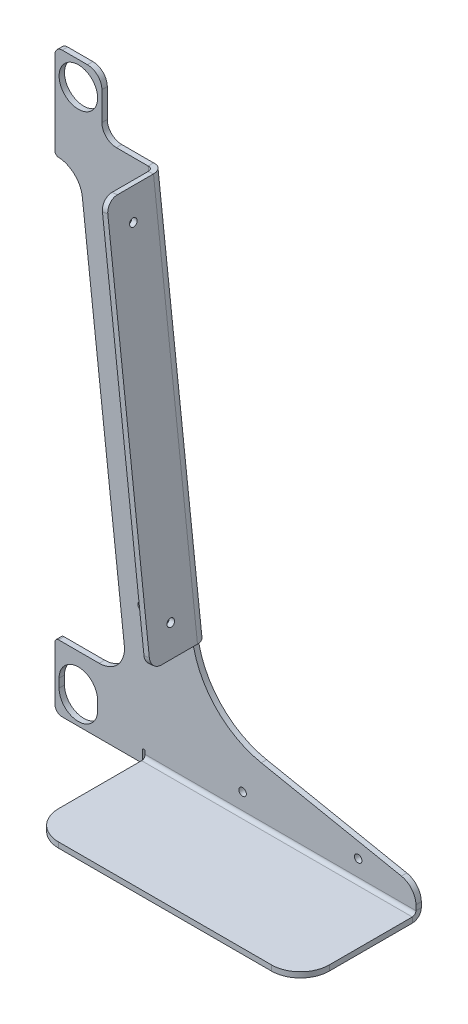
from build123d import *

# Parameters (mm, degrees)
BOSS_EXTRUDE1_DEPTH      = 3.175
SKETCH2_R                = 16.9545
CUT_EXTRUDE1_DEPTH       = 600.06621556
FILLET1_R                = 15.875
CONVERT_SOLID1_START     = -1.5875
CONVERT_SOLID1_OUTLINE_R = 16.9545
CONVERT_SOLID1_DEPTH     = 1.5875
EDGE_FLANGE1_START       = 76.99375
EDGE_FLANGE1_DEPTH       = 240.50625
EDGE_FLANGE1_START_2     = 79.375
EDGE_FLANGE1_2_DEPTH     = 238.125
EDGE_FLANGE1_START_3     = -3
EDGE_FLANGE1_3_DEPTH     = 9.35
FILLET2_R                = 25.4
FILLET3_R                = 3.175
CUT_EXTRUDE2_DEPTH       = 4.7625
FILLET4_R                = 3.175
EDGE_FLANGE3_DEPTH       = 341.057724741
FILLET5_R                = 9.525
CUT_EXTRUDE3_DEPTH       = 4.7625
FILLET7_R                = 12.7
SKETCH17_R               = 3.302
CUT_EXTRUDE4_DEPTH       = 608.612384802
CUT_EXTRUDE5_DEPTH       = 608.612384802
SKETCH19_R               = 3.302
CUT_EXTRUDE6_DEPTH       = 533.561746786


with BuildPart() as part:
    # Sketch1 → Boss-Extrude1 (new body)
    with BuildSketch(Plane.XY):
        with BuildLine():
            Line((6.35, 0), (317.5, 0))
            Line((317.5, 0), (317.5, 25.4))
            Line((317.5, 25.4), (181.457249023, 52.608550195))
            ThreePointArc((181.457249023, 52.608550195), (140.315142877, 75.746018143), (120.694108864, 118.676547437))
            Line((120.694108864, 118.676547437), (76.2, 508))
            Line((76.2, 508), (6.35, 508))
            ThreePointArc((6.35, 508), (1.859871939, 506.140128061), (0, 501.65))
            Line((0, 501.65), (0, 6.35))
            ThreePointArc((0, 6.35), (1.859871939, 1.859871939), (6.35, 0))
        make_face()
    extrude(amount=BOSS_EXTRUDE1_DEPTH)

    # Sketch2 → Cut-Extrude1 (cut, through all)
    with BuildSketch(Plane.XY.offset(3.175)):
        with Locations((20.574, 486.9942)):
            Circle(SKETCH2_R)
        with Locations((20.574, 20.574)):
            Circle(SKETCH2_R)
    extrude(amount=-CUT_EXTRUDE1_DEPTH, mode=Mode.SUBTRACT)

    # Fillet1
    fillet1_edges = [part.edges().sort_by_distance(p)[0] for p in [
        (317.5, 25.4, 1.5875),
    ]]
    fillet(fillet1_edges, radius=FILLET1_R)

    # Convert-Solid1: read off the stored shape, not the designer's step
    # Convert-Solid1 outline → Convert-Solid1 (add)
    with BuildSketch(Plane.XY.offset(CONVERT_SOLID1_START)):
        with BuildLine():
            Line((304.738343645, 27.952331271), (181.457249023, 52.608550195))
            ThreePointArc((181.457249023, 52.608550195), (140.315142877, 75.746018143), (120.694108864, 118.676547437))
            Line((120.694108864, 118.676547437), (76.2, 508))
            Line((76.2, 508), (6.35, 508))
            ThreePointArc((6.35, 508), (1.859871939, 506.140128061), (0, 501.65))
            Line((0, 501.65), (0, 6.35))
            ThreePointArc((0, 6.35), (1.859871939, 1.859871939), (6.35, 0))
            Line((6.35, 0), (317.5, 0))
            Line((317.5, 0), (317.5, 12.385613044))
            ThreePointArc((317.5, 12.385613044), (313.901806494, 22.450186921), (304.738343645, 27.952331271))
        make_face()
        with Locations((20.574, 20.574)):
            Circle(CONVERT_SOLID1_OUTLINE_R, mode=Mode.SUBTRACT)
        with Locations((20.574, 486.9942)):
            Circle(CONVERT_SOLID1_OUTLINE_R, mode=Mode.SUBTRACT)
    extrude(amount=CONVERT_SOLID1_DEPTH)

    # Edge-Flange1: read off the stored shape, not the designer's step
    # Edge-Flange1 outline → Edge-Flange1 (cut)
    with BuildSketch(Plane.YZ.offset(EDGE_FLANGE1_START)):
        with BuildLine():
            ThreePointArc((7.9375, -1.5875), (3.589952199, -0.290988961), (0.662661084, 3.175))
            Line((0.662661084, 3.175), (0, 3.175))
            Line((0, 3.175), (0, -1.5875))
            Line((0, -1.5875), (7.9375, -1.5875))
        make_face()
    extrude(amount=EDGE_FLANGE1_DEPTH, mode=Mode.SUBTRACT)

    # Edge-Flange1 2 outline → Edge-Flange1 2 (add)
    with BuildSketch(Plane.YZ.offset(EDGE_FLANGE1_START_2)):
        with BuildLine():
            Line((0, 104.775), (0, 6.35))
            ThreePointArc((0, 6.35), (0.167431141, 4.728292203), (0.662661084, 3.175))
            Line((0.662661084, 3.175), (7.9375, 3.175))
            ThreePointArc((7.9375, 3.175), (5.69243597, 4.10493597), (4.7625, 6.35))
            Line((4.7625, 6.35), (4.7625, 104.775))
            Line((4.7625, 104.775), (0, 104.775))
        make_face()
    extrude(amount=EDGE_FLANGE1_2_DEPTH)

    # Edge-Flange1 3 outline → Edge-Flange1 3 (cut)
    with BuildSketch(Plane.XY.offset(EDGE_FLANGE1_START_3)):
        with BuildLine():
            Line((79.375, -1), (79.375, 10.31875))
            ThreePointArc((79.375, 10.31875), (78.184375, 11.509375), (76.99375, 10.31875))
            Line((76.99375, 10.31875), (76.99375, -1))
            Line((76.99375, -1), (79.375, -1))
        make_face()
    extrude(amount=EDGE_FLANGE1_3_DEPTH, mode=Mode.SUBTRACT)

    # Fillet2
    fillet2_edges = [part.edges().sort_by_distance(p)[0] for p in [
        (79.375, 2.38125, 104.775),
        (317.5, 2.38125, 104.775),
    ]]
    fillet(fillet2_edges, radius=FILLET2_R)

    # Fillet3
    fillet3_edges = [part.edges().sort_by_distance(p)[0] for p in [
        (76.99375, 0, 0.79375),
    ]]
    fillet(fillet3_edges, radius=FILLET3_R)

    # Sketch7 → Cut-Extrude2 (cut)
    with BuildSketch(Plane.XY.offset(3.175)):
        with BuildLine():
            Line((24.053808826, 405.037372989), (60.983957397, 81.898572989))
            ThreePointArc((60.983957397, 81.898572989), (55.486376009, 64.57864546), (38.902693748, 57.15))
            Line((38.902693748, 57.15), (0, 57.15))
            Line((0, 57.15), (0, 424.7388))
            Line((0, 424.7388), (1.972545176, 424.7388))
            ThreePointArc((1.972545176, 424.7388), (16.768899716, 419.097482261), (24.053808826, 405.037372989))
        make_face()
    extrude(amount=-CUT_EXTRUDE2_DEPTH, mode=Mode.SUBTRACT)

    # Fillet4
    fillet4_edges = [part.edges().sort_by_distance(p)[0] for p in [
        (0, 424.7388, 0.79375),
        (0, 57.15, 0.79375),
    ]]
    fillet(fillet4_edges, radius=FILLET4_R)

    # Edge-Flange3: sheet metal written as solids
    # Edge-Flange3 section (on a plane across the edge) → Edge-Flange3 (add)
    with BuildSketch(Plane(origin=(125.425808218, 119.217313077, 3.175), x_dir=(-0.9935326726564042, -0.11354659116073179, 3.4914813388431334e-15), z_dir=(-0.11354659116073179, 0.9935326726564042, 0))):
        with BuildLine():
            Line((-4.7625, 4.7625), (-4.7625, 46.0375))
            Line((-4.7625, 46.0375), (0, 46.0375))
            Line((0, 46.0375), (0, 4.7625))
            ThreePointArc((0, 4.7625), (1.394903955, 1.394903955), (4.7625, 0))
            Line((4.7625, 0), (4.7625, -4.7625))
            ThreePointArc((4.7625, -4.7625), (-1.972692091, -1.972692091), (-4.7625, 4.7625))
        make_face()
    extrude(amount=EDGE_FLANGE3_DEPTH)

    # Fillet5
    fillet5_edges = [part.edges().sort_by_distance(p)[0] for p in [
        (127.791657895, 119.487695897, 49.2125),
        (89.065715861, 458.33968869, 49.2125),
    ]]
    fillet(fillet5_edges, radius=FILLET5_R)

    # Sketch16 → Cut-Extrude3 (cut)
    with BuildSketch(Plane.XY.offset(3.175)):
        Polygon((76.2, 508), (41.275, 508), (41.275, 457.528540229), (81.968166831, 457.528540229), align=None)
    extrude(amount=-CUT_EXTRUDE3_DEPTH, mode=Mode.SUBTRACT)

    # Fillet7
    fillet7_edges = [part.edges().sort_by_distance(p)[0] for p in [
        (41.275, 457.528540229, 0.79375),
        (41.275, 508, 0.79375),
    ]]
    fillet(fillet7_edges, radius=FILLET7_R)

    # Sketch17 → Cut-Extrude4 (cut, through all)
    with BuildSketch(Plane.XY.offset(3.175)):
        with Locations((76.2, 423.892006342)):
            Circle(SKETCH17_R)
        with Locations((76.2, 347.692006342)):
            Circle(SKETCH17_R)
        with Locations((76.2, 271.492006342)):
            Circle(SKETCH17_R)
        with Locations((76.2, 195.292006342)):
            Circle(SKETCH17_R)
        with Locations((76.2, 119.092006342)):
            Circle(SKETCH17_R)
        with Locations((266.7, 22.225)):
            Circle(SKETCH17_R)
        with Locations((165.1, 22.225)):
            Circle(SKETCH17_R)
    extrude(amount=-CUT_EXTRUDE4_DEPTH, mode=Mode.SUBTRACT)

    # Sketch18 → Cut-Extrude5 (cut, through all)
    with BuildSketch(Plane.XY.offset(3.175)):
        with BuildLine():
            Line((3.6195, 28.2067), (3.6195, 20.574))
            ThreePointArc((3.6195, 20.574), (20.574, 3.6195), (37.5285, 20.574))
            Line((37.5285, 20.574), (37.5285, 28.2067))
            ThreePointArc((37.5285, 28.2067), (20.574, 45.1612), (3.6195, 28.2067))
        make_face()
    extrude(amount=-CUT_EXTRUDE5_DEPTH, mode=Mode.SUBTRACT)

    # Sketch19 → Cut-Extrude6 (cut, through all)
    with BuildSketch(Plane(origin=(141.989587265, 16.227381402, 0), x_dir=(0, 0, -1), z_dir=(0.9935326726564043, 0.1135465911607318, -3.62817709114321e-15))):
        with Locations(Location((-28.575, 419.862347463, 0), (0, 0, 90))):
            Circle(SKETCH19_R)
        with Locations(Location((-28.575, 129.604622722, 0), (0, 0, 90))):
            Circle(SKETCH19_R)
    extrude(amount=-CUT_EXTRUDE6_DEPTH, mode=Mode.SUBTRACT)


solid = part.part
